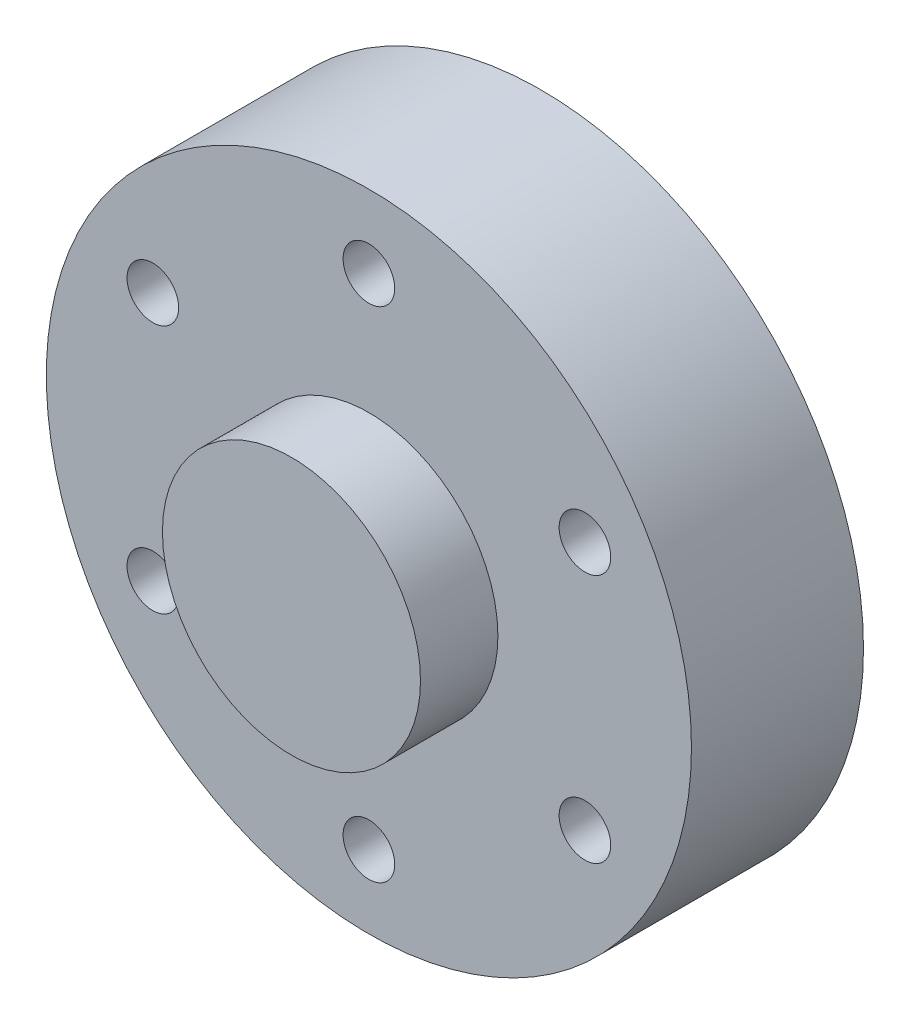
from build123d import *

# Parameters (mm, degrees)
SKETCH2_R           = 18.75
SKETCH2_R_2         = 1.5
BOSS_EXTRUDE1_DEPTH = 10
SKETCH3_R           = 7.5
BOSS_EXTRUDE2_DEPTH = 4.5
BOSS_EXTRUDE4_START = 4.5
SKETCH6_R           = 7.5
BOSS_EXTRUDE4_DEPTH = 4.5
SKETCH7_R           = 2
BOSS_EXTRUDE5_DEPTH = 1
FILLET2_R           = 0.05
SKETCH9_R           = 1.7
CUT_EXTRUDE1_DEPTH  = 13
SKETCH10_R          = 0.8
CUT_EXTRUDE2_DEPTH  = 5


with BuildPart() as part:
    # Sketch2 → Boss-Extrude1 (new body)
    with BuildSketch(Plane.XY):
        Circle(SKETCH2_R)
        with Locations((0, -14.5)):
            Circle(SKETCH2_R_2, mode=Mode.SUBTRACT)
        with Locations((-12.557368355, -7.25)):
            Circle(SKETCH2_R_2, mode=Mode.SUBTRACT)
        with Locations((12.557368355, -7.25)):
            Circle(SKETCH2_R_2, mode=Mode.SUBTRACT)
        with Locations((-12.557368355, 7.25)):
            Circle(SKETCH2_R_2, mode=Mode.SUBTRACT)
        with Locations((0, 14.5)):
            Circle(SKETCH2_R_2, mode=Mode.SUBTRACT)
        with Locations((12.557368355, 7.25)):
            Circle(SKETCH2_R_2, mode=Mode.SUBTRACT)
    extrude(amount=BOSS_EXTRUDE1_DEPTH)

    # Sketch3 → Boss-Extrude2 (add)
    with BuildSketch(Plane.XY.offset(10)):
        Circle(SKETCH3_R)
    extrude(amount=BOSS_EXTRUDE2_DEPTH)

    # Sketch6 → Boss-Extrude4 (add)
    with BuildSketch(Plane(origin=(0, 0, 0), x_dir=(-1, 0, 0), z_dir=(0, 0, -1)).offset(BOSS_EXTRUDE4_START)):
        Circle(SKETCH6_R)
    extrude(amount=-BOSS_EXTRUDE4_DEPTH)

    # Sketch7 → Boss-Extrude5 (add)
    with BuildSketch(Plane(origin=(0, 0, -4.5), x_dir=(-1, 0, 0), z_dir=(0, 0, -1))):
        Circle(SKETCH7_R)
    extrude(amount=BOSS_EXTRUDE5_DEPTH)

    # Fillet2
    fillet2_edges = [part.edges().sort_by_distance(p)[0] for p in [
        (2, 0, -5.5),
    ]]
    fillet(fillet2_edges, radius=FILLET2_R)

    # Sketch9 → Cut-Extrude1 (cut)
    with BuildSketch(Plane(origin=(0, 0, -5.5), x_dir=(-1, 0, 0), z_dir=(0, 0, -1))):
        Circle(SKETCH9_R)
    extrude(amount=-CUT_EXTRUDE1_DEPTH, mode=Mode.SUBTRACT)

    # Sketch10 → Cut-Extrude2 (cut)
    with BuildSketch(Plane(origin=(0, 0, -4.5), x_dir=(-1, 0, 0), z_dir=(0, 0, -1))):
        with Locations((0, 4.5)):
            Circle(SKETCH10_R)
        with Locations((0, -4.5)):
            Circle(SKETCH10_R)
    extrude(amount=-CUT_EXTRUDE2_DEPTH, mode=Mode.SUBTRACT)


solid = part.part
